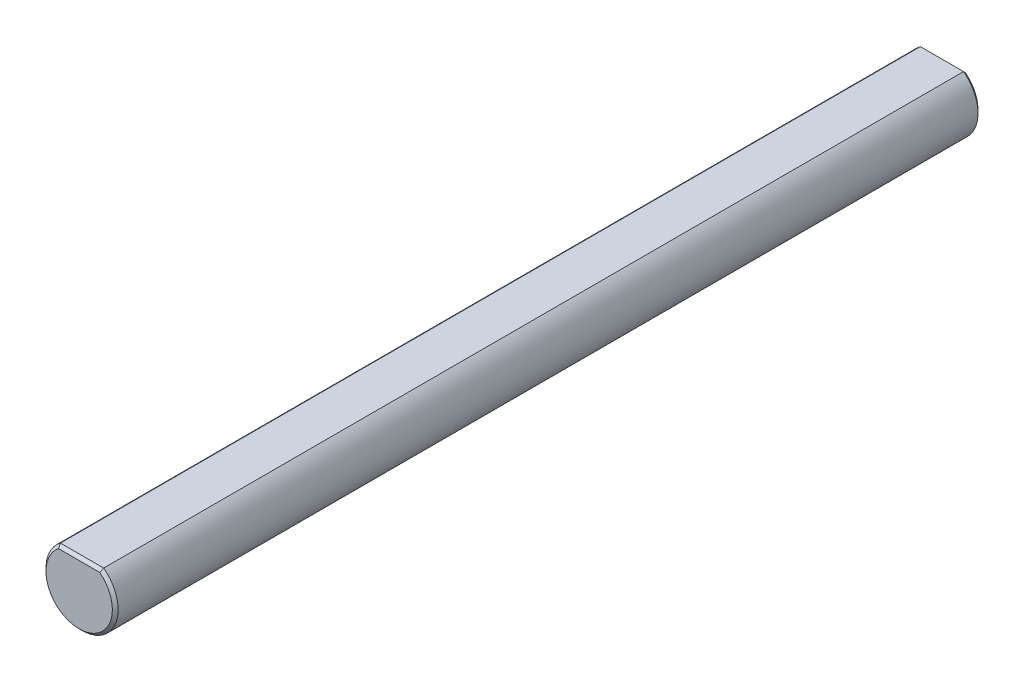
from build123d import *

# Parameters (mm, degrees)
BOSS_EXTRUDE1_DEPTH = 38.1
CHAMFER1_SIZE       = 0.254


with BuildPart() as part:
    # Sketch1 → Boss-Extrude1 (new, symmetric)
    with BuildSketch(Plane.XY):
        with BuildLine():
            Line((1.905, 2.54), (-1.905, 2.54))
            ThreePointArc((-1.905, 2.54), (0, -3.175), (1.905, 2.54))
        make_face()
    extrude(amount=BOSS_EXTRUDE1_DEPTH, both=True)

    # Chamfer1
    chamfer1_edges = [part.edges().sort_by_distance(p)[0] for p in [
        (0, 2.54, 38.1),
        (0, -3.175, 38.1),
        (0, 2.54, -38.1),
        (0, -3.175, -38.1),
    ]]
    chamfer(chamfer1_edges, length=CHAMFER1_SIZE)


solid = part.part
